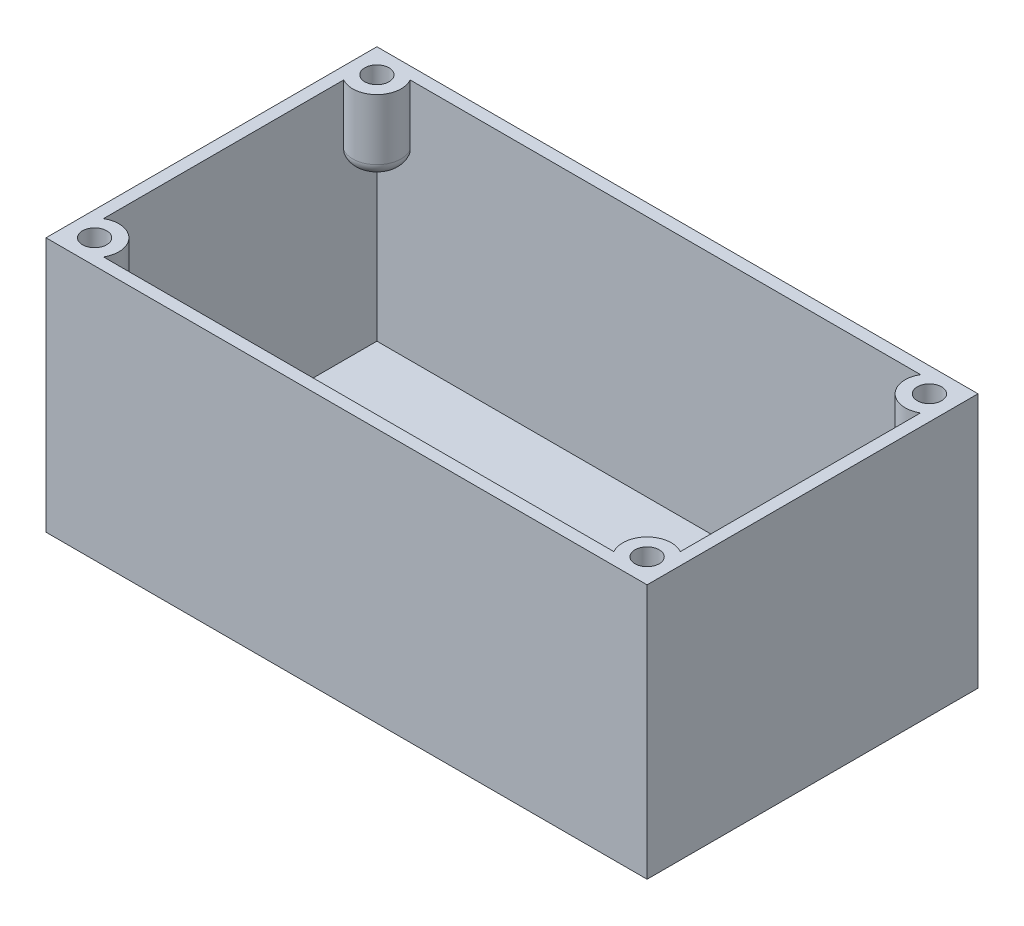
from build123d import *

# Parameters (mm, degrees)
SKETCH1_W           = 99
SKETCH1_H           = 54.5
BOSS_EXTRUDE1_DEPTH = 2
SKETCH2_W           = 99
SKETCH2_H           = 54.5
SKETCH2_W_2         = 95
SKETCH2_H_2         = 50.5
BOSS_EXTRUDE2_DEPTH = 40
SKETCH4_R           = 3.5
SKETCH4_R_2         = 2
BOSS_EXTRUDE3_DEPTH = 8
CUT_EXTRUDE1_START  = -2
SKETCH4_2_R         = 2
CUT_EXTRUDE1_DEPTH  = 2
SKETCH6_W           = 8.3
SKETCH6_H           = 3.1
CUT_EXTRUDE2_DEPTH  = 2
BOSS_EXTRUDE4_DEPTH = 12
SKETCH7_4_R         = 2
CUT_EXTRUDE3_DEPTH  = 10
FILLET1_R           = 2


with BuildPart() as part:
    # Sketch1 → Boss-Extrude1 (new body)
    with BuildSketch(Plane(origin=(0, 0, 0), x_dir=(1, 0, 0), z_dir=(0, 1, 0))):
        Rectangle(SKETCH1_W, SKETCH1_H)
    extrude(amount=BOSS_EXTRUDE1_DEPTH)

    # Sketch2 → Boss-Extrude2 (add)
    with BuildSketch(Plane(origin=(0, 2, 0), x_dir=(1, 0, 0), z_dir=(0, 1, 0))):
        Rectangle(SKETCH2_W, SKETCH2_H)
        Rectangle(SKETCH2_W_2, SKETCH2_H_2, mode=Mode.SUBTRACT)
    extrude(amount=BOSS_EXTRUDE2_DEPTH)

    # Sketch4 → Boss-Extrude3 (add)
    # profile 1 of 2: a face of its own
    with BuildSketch(Plane(origin=(0, 2, 0), x_dir=(1, 0, 0), z_dir=(0, 1, 0))):
        with Locations(Location((-41.5, -19.25, 0), (0, 0, 270))):
            Circle(SKETCH4_R)
        with Locations(Location((-41.5, -19.25, 0), (0, 0, 270))):
            Circle(SKETCH4_R_2, mode=Mode.SUBTRACT)
    # profile 2 of 2: a face of its own
    with BuildSketch(Plane(origin=(0, 2, 0), x_dir=(1, 0, 0), z_dir=(0, 1, 0))):
        with Locations(Location((-41.5, -10.75, 0), (0, 0, 270))):
            Circle(SKETCH4_R)
        with Locations(Location((-41.5, -10.75, 0), (0, 0, 270))):
            Circle(SKETCH4_R_2, mode=Mode.SUBTRACT)
    extrude(amount=BOSS_EXTRUDE3_DEPTH)

    # Sketch4<2> → Cut-Extrude1 (cut)
    with BuildSketch(Plane(origin=(0, 2, 0), x_dir=(1, 0, 0), z_dir=(0, 1, 0)).offset(CUT_EXTRUDE1_START)):
        with Locations(Location((-41.5, -10.75, 0), (0, 0, 270))):
            Circle(SKETCH4_2_R)
        with Locations(Location((-41.5, -19.25, 0), (0, 0, 270))):
            Circle(SKETCH4_2_R)
    extrude(amount=CUT_EXTRUDE1_DEPTH, mode=Mode.SUBTRACT)

    # Sketch6 → Cut-Extrude2 (cut)
    with BuildSketch(Plane(origin=(-47.5, 0, 0), x_dir=(0, 0, -1), z_dir=(1, 0, 0))):
        with Locations((-15, 13.15)):
            Rectangle(SKETCH6_W, SKETCH6_H)
    extrude(amount=-CUT_EXTRUDE2_DEPTH, mode=Mode.SUBTRACT)

    # Sketch7 → Boss-Extrude4 (add)
    with BuildSketch(Plane(origin=(0, 42, 0), x_dir=(1, 0, 0), z_dir=(0, 1, 0))):
        with BuildLine():
            ThreePointArc((-47.5, 19.785898385), (-42.671572875, 20.421572875), (-42.035898385, 25.25))
            Line((-42.035898385, 25.25), (-47.5, 25.25))
            Line((-47.5, 25.25), (-47.5, 19.785898385))
        make_face()
        with BuildLine():
            ThreePointArc((42.035898385, 25.25), (42.671572875, 20.421572875), (47.5, 19.785898385))
            Line((47.5, 19.785898385), (47.5, 25.25))
            Line((47.5, 25.25), (42.035898385, 25.25))
        make_face()
        with BuildLine():
            Line((47.5, -25.25), (47.5, -19.785898385))
            ThreePointArc((47.5, -19.785898385), (42.671572875, -20.421572875), (42.035898385, -25.25))
            Line((42.035898385, -25.25), (47.5, -25.25))
        make_face()
        with BuildLine():
            ThreePointArc((-42.035898385, -25.25), (-42.671572875, -20.421572875), (-47.5, -19.785898385))
            Line((-47.5, -19.785898385), (-47.5, -25.25))
            Line((-47.5, -25.25), (-42.035898385, -25.25))
        make_face()
    extrude(amount=-BOSS_EXTRUDE4_DEPTH)

    # Sketch7<4> → Cut-Extrude3 (cut)
    with BuildSketch(Plane(origin=(0, 42, 0), x_dir=(1, 0, 0), z_dir=(0, 1, 0))):
        with Locations(Location((-45.5, 23.25, 0), (0, 0, 270))):
            Circle(SKETCH7_4_R)
        with Locations(Location((45.5, 23.25, 0), (0, 0, 90))):
            Circle(SKETCH7_4_R)
        with Locations(Location((-45.5, -23.25, 0), (0, 0, 90))):
            Circle(SKETCH7_4_R)
        with Locations(Location((45.5, -23.25, 0), (0, 0, 270))):
            Circle(SKETCH7_4_R)
    extrude(amount=-CUT_EXTRUDE3_DEPTH, mode=Mode.SUBTRACT)

    # Fillet1
    fillet1_edges = [part.edges().sort_by_distance(p)[0] for p in [
        (42.671572875, 30, -20.421572875),
        (-42.671572875, 30, 20.421572875),
        (-42.671572875, 30, -20.421572875),
        (42.671572875, 30, 20.421572875),
    ]]
    fillet(fillet1_edges, radius=FILLET1_R - 0.0001)  # a hair under: the kernel refuses the full size


solid = part.part
